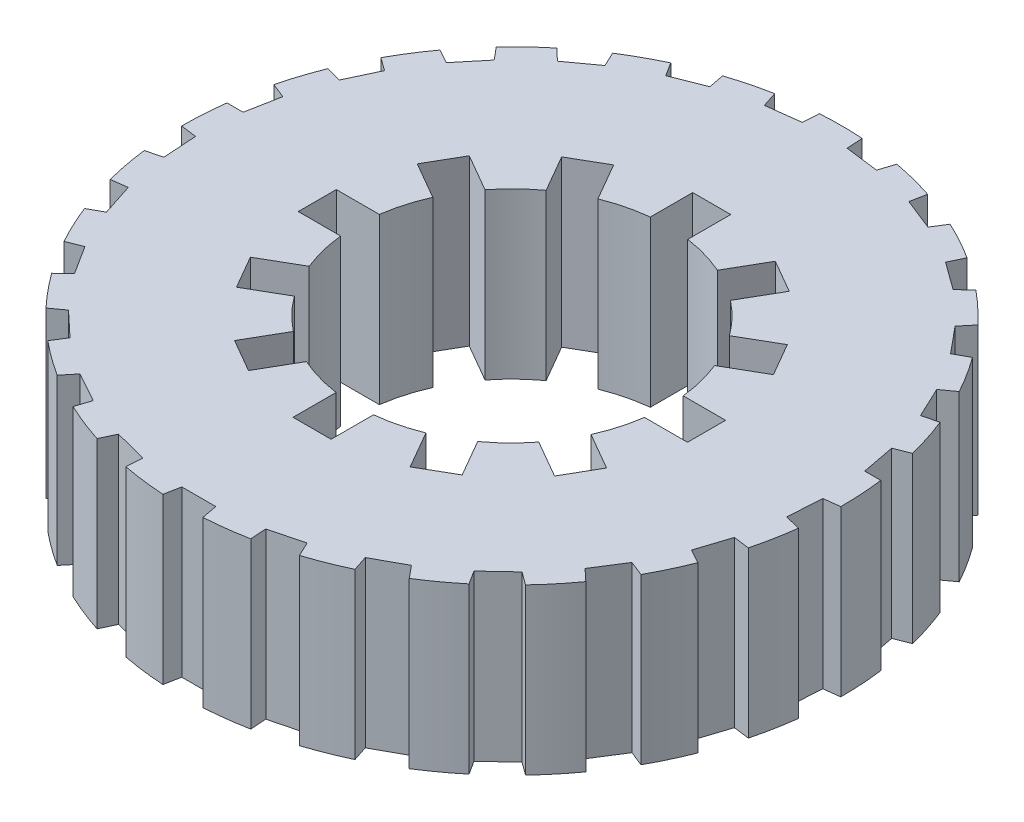
from build123d import *

# Parameters (mm, degrees)
SKETCH1_R           = 38.1
BOSS_EXTRUDE1_DEPTH = 19.05
CUT_EXTRUDE1_DEPTH  = 33
CIRPATTERN1_COUNT   = 25
CUT_EXTRUDE2_DEPTH  = 28
CUT_EXTRUDE8_DEPTH  = 23
CIRPATTERN2_COUNT   = 12


with BuildPart() as part:
    # Sketch1 → Boss-Extrude1 (new body)
    with BuildSketch(Plane(origin=(0, 0, 0), x_dir=(1, 0, 0), z_dir=(0, 1, 0))):
        Circle(SKETCH1_R)
    extrude(amount=BOSS_EXTRUDE1_DEPTH)

    # Sketch2 → Cut-Extrude1 (cut)
    with BuildSketch(Plane.XZ):
        Polygon((-1.965720517, 36.2), (1.965720517, 36.2), (2.3241, 38.105), (-2.3241, 38.105), align=None)
    cut_extrude1 = extrude(amount=-CUT_EXTRUDE1_DEPTH, mode=Mode.SUBTRACT)

    # CirPattern1: Cut-Extrude1 ×25 about axis
    cirpattern1_axis = Axis((0, 0, 0), (0, 1, 0))
    for i in range(1, CIRPATTERN1_COUNT):
        add(cut_extrude1.rotate(cirpattern1_axis, i * 360 / CIRPATTERN1_COUNT), mode=Mode.SUBTRACT)

    # Sketch3 → Cut-Extrude2 (cut)
    with BuildSketch(Plane(origin=(0, 19.05, 0), x_dir=(1, 0, 0), z_dir=(0, 1, 0))):
        with BuildLine():
            ThreePointArc((2.5, 17.82554347), (0.302266808, 17.997461898), (-1.9, 17.899441332))
            ThreePointArc((-1.9, 17.899441332), (-12.037441589, -13.382824814), (18, 0))
            ThreePointArc((18, 0), (13.583077707, 11.811011811), (2.5, 17.82554347))
        make_face()
    extrude(amount=-CUT_EXTRUDE2_DEPTH, mode=Mode.SUBTRACT)

    # Sketch3<7> → Cut-Extrude8 (cut)
    with BuildSketch(Plane(origin=(0, 19.05, 0), x_dir=(1, 0, 0), z_dir=(0, 1, 0))):
        with BuildLine():
            Line((0.3, 22.8), (-1.9, 22.8))
            Line((-1.9, 22.8), (-1.9, 17.899441332))
            ThreePointArc((-1.9, 17.899441332), (0.302266808, 17.997461898), (2.5, 17.82554347))
            Line((2.5, 17.82554347), (2.5, 22.8))
            Line((2.5, 22.8), (0.3, 22.8))
        make_face()
    cut_extrude8 = extrude(amount=-CUT_EXTRUDE8_DEPTH, mode=Mode.SUBTRACT)

    # CirPattern2: Cut-Extrude8 ×12 about axis
    cirpattern2_axis = Axis((0, 19.05, 0), (0, 1, 0))
    for i in range(1, CIRPATTERN2_COUNT):
        add(cut_extrude8.rotate(cirpattern2_axis, i * 360 / CIRPATTERN2_COUNT), mode=Mode.SUBTRACT)


solid = part.part
